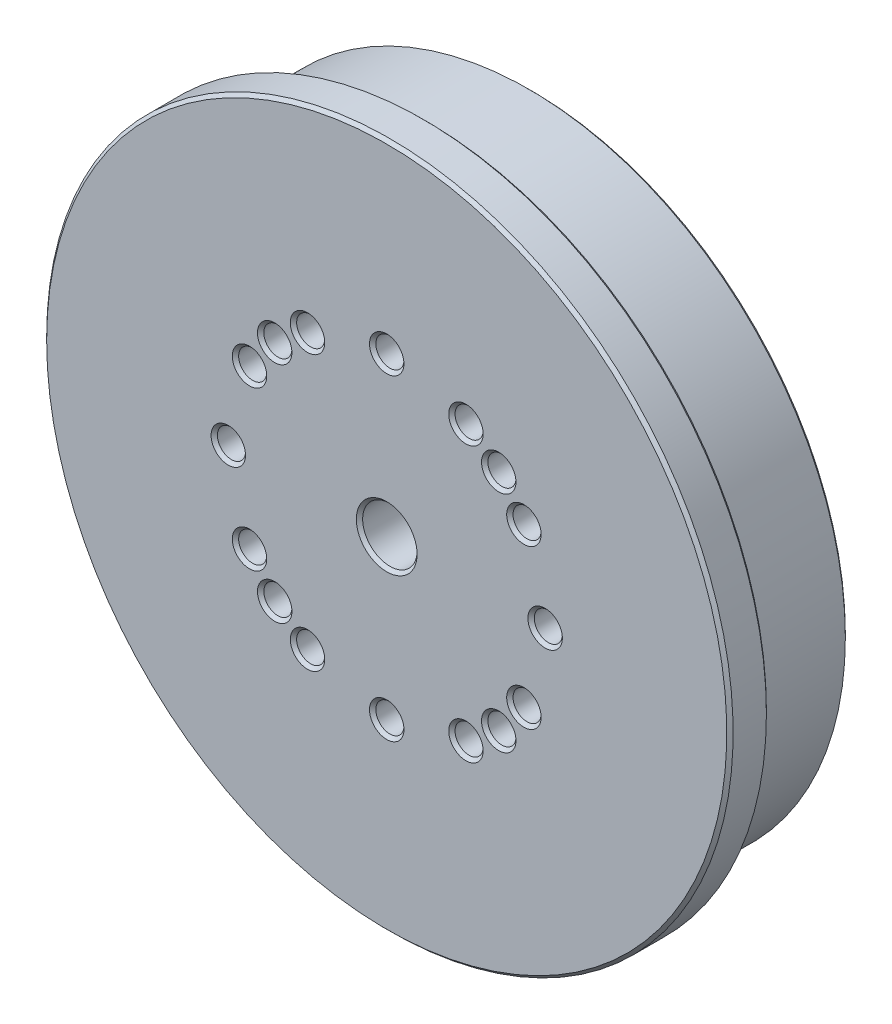
from build123d import *

# Parameters (mm, degrees)
SKETCH1_R               = 76.1365
MAIN_DEPTH              = 25.4
SKETCH2_R               = 82.55
SHOULDER_DEPTH          = 9.525
F_1_2_CLEARANCE_HOLE1_D = 13.09624
F_1_4_CLEARANCE_HOLE1_D = 6.7564
CHAMFER1_SIZE           = 0.762


with BuildPart() as part:
    # Sketch1 → Main (new body)
    with BuildSketch(Plane.XY):
        Circle(SKETCH1_R)
    extrude(amount=MAIN_DEPTH)

    # Sketch2 → Shoulder (add)
    with BuildSketch(Plane.XY.offset(25.4)):
        Circle(SKETCH2_R)
    extrude(amount=SHOULDER_DEPTH)

    # 1/2 Clearance Hole1 (through all)
    with Locations(Plane.XY.offset(34.925)):
        with Locations((0, 0)):
            Hole(F_1_2_CLEARANCE_HOLE1_D / 2)

    # 1/4 Clearance Hole1 (through all)
    with Locations(Plane.XY.offset(34.925)):
        with Locations((19.05, -32.995567884), (0, 38.1), (26.940768363, 26.940768363), (38.1, 0), (0, -38.1), (-38.1, 0), (26.940768363, -26.940768363), (-26.940768363, -26.940768363), (-26.940768363, 26.940768363), (-19.05, 32.995567884), (19.05, 32.995567884), (32.995567884, 19.05), (-32.995567884, 19.05), (-32.995567884, -19.05), (32.995567884, -19.05), (-19.05, -32.995567884)):
            Hole(F_1_4_CLEARANCE_HOLE1_D / 2)

    # Chamfer1
    chamfer1_edges = [part.edges().sort_by_distance(p)[0] for p in [
        (-76.1365, 0, 0),
        (-82.55, 0, 34.925),
        (-82.55, 0, 25.4),
        (6.54812, 0, 0),
        (-29.617367884, 19.05, 0),
        (36.373767884, 19.05, 0),
        (22.4282, 32.995567884, 0),
        (-15.6718, 32.995567884, 0),
        (-23.562568363, 26.940768363, 0),
        (-23.562568363, -26.940768363, 0),
        (30.318968363, -26.940768363, 0),
        (-34.7218, 0, 0),
        (3.3782, -38.1, 0),
        (41.4782, 0, 0),
        (30.318968363, 26.940768363, 0),
        (3.3782, 38.1, 0),
        (6.54812, 0, 34.925),
        (-29.617367884, 19.05, 34.925),
        (36.373767884, 19.05, 34.925),
        (22.4282, 32.995567884, 34.925),
        (-15.6718, 32.995567884, 34.925),
        (-23.562568363, 26.940768363, 34.925),
        (-23.562568363, -26.940768363, 34.925),
        (30.318968363, -26.940768363, 34.925),
        (-34.7218, 0, 34.925),
        (3.3782, -38.1, 34.925),
        (41.4782, 0, 34.925),
        (30.318968363, 26.940768363, 34.925),
        (3.3782, 38.1, 34.925),
        (22.4282, -32.995567884, 0),
        (-15.6718, -32.995567884, 0),
        (36.373767884, -19.05, 0),
        (-29.617367884, -19.05, 0),
        (22.4282, -32.995567884, 34.925),
        (-15.6718, -32.995567884, 34.925),
        (36.373767884, -19.05, 34.925),
        (-29.617367884, -19.05, 34.925),
    ]]
    chamfer(chamfer1_edges, length=CHAMFER1_SIZE)


solid = part.part
